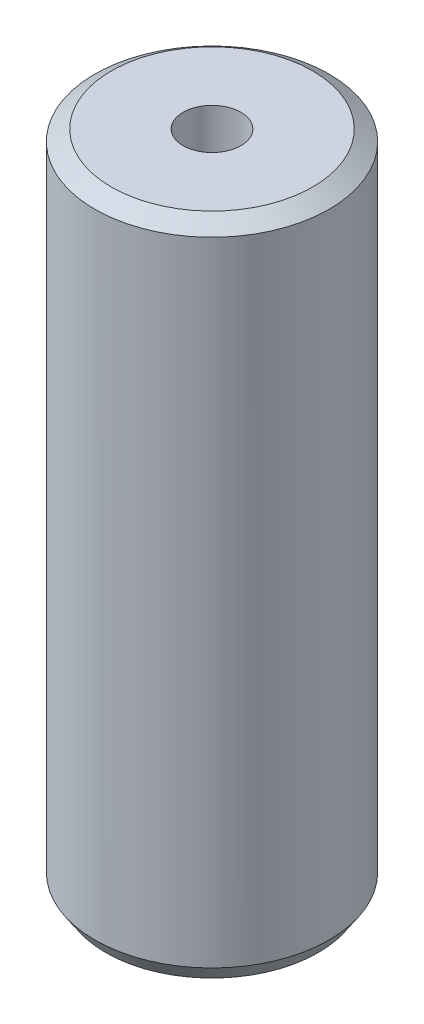
from build123d import *
from OCP.BRepFilletAPI import BRepFilletAPI_MakeChamfer

# Parameters (mm, degrees)
SKETCH1_R           = 5
BOSS_EXTRUDE1_DEPTH = 28.181879093
SKETCH2_R           = 1.234687677
CUT_EXTRUDE1_DEPTH  = 30.055435106
CHAMFER1_SIZE       = 0.469195133
CHAMFER1_SIZE2      = 0.705002986


with BuildPart() as part:
    # Sketch1 → Boss-Extrude1 (new body)
    with BuildSketch(Plane(origin=(0, 0, 0), x_dir=(1, 0, 0), z_dir=(0, 1, 0))):
        Circle(SKETCH1_R)
    extrude(amount=BOSS_EXTRUDE1_DEPTH)

    # Sketch2 → Cut-Extrude1 (cut, through all)
    with BuildSketch(Plane(origin=(0, 0, 0), x_dir=(1, 0, 0), z_dir=(0, 1, 0))):
        Circle(SKETCH2_R)
    extrude(amount=CUT_EXTRUDE1_DEPTH, mode=Mode.SUBTRACT)

    # Chamfer1: one chamfer whose edges measure the first distance from different faces: ONE call of the kernel's chamfer builder (chamfer() names one face for all edges)
    chamfer1_edges_1 = [part.edges().sort_by_distance(p)[0] for p in [
        (-5, 28.181879093, 0),
    ]]
    chamfer1_side_1 = [part.faces().sort_by_distance(p)[0] for p in [
        (-5, 14.090939546, 0),
    ]]
    chamfer1_edges_2 = [part.edges().sort_by_distance(p)[0] for p in [
        (-5, 0, 0),
    ]]
    chamfer1_side_2 = [part.faces().sort_by_distance(p)[0] for p in [
        (-4.858578644, 0, 0),
    ]]
    chamfer1 = BRepFilletAPI_MakeChamfer(part.part.solid().wrapped)
    for e in chamfer1_edges_1:
        chamfer1.Add(CHAMFER1_SIZE, CHAMFER1_SIZE2, e.wrapped, chamfer1_side_1[0].wrapped)  # the first distance lies on this face
    for e in chamfer1_edges_2:
        chamfer1.Add(CHAMFER1_SIZE, CHAMFER1_SIZE2, e.wrapped, chamfer1_side_2[0].wrapped)  # the first distance lies on this face
    add(Compound.cast(chamfer1.Shape()), mode=Mode.REPLACE)


solid = part.part
